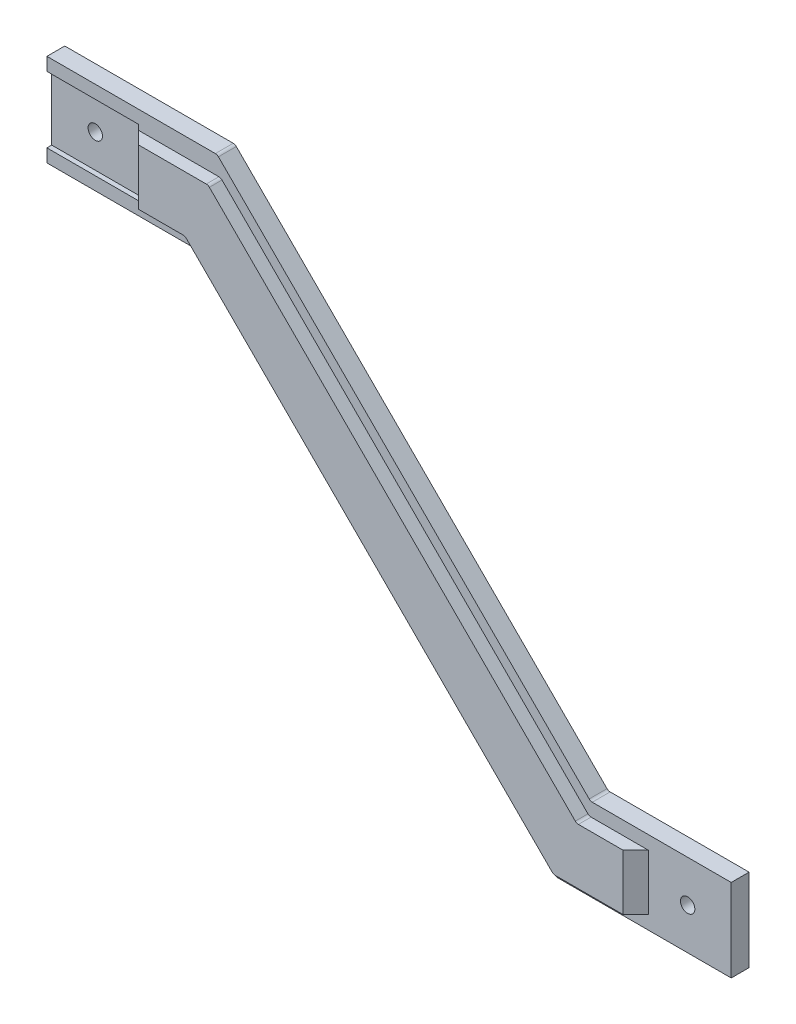
from build123d import *

# Parameters (mm, degrees)
SKETCH_1_R          = 1.65
EXTRUDE_1_DEPTH     = 3
EXTRUDE_2_DEPTH     = 2.9
CHAMFER_1_SIZE      = 2.9
EXTRUDE_START       = -1.1
SKETCH_6_R          = 1.65
EXTRUDE_3_DEPTH     = 4.1
CUT_EXTRUDE_START   = 3
SKETCH_7_W          = 21
SKETCH_7_H          = 15.2
CUT_EXTRUDE_1_DEPTH = 1.1
FILLET_1_R          = 1


with BuildPart() as part:
    # 草图1 → 凸台-拉伸1 (new body)
    with BuildSketch(Plane.XY):
        Polygon((-78.55, 51.8), (-38.364971157, 51.8), (46.235028843, -32.8), (78.55, -32.8), (78.55, -51.8), (38.364971157, -51.8), (-46.235028843, 32.8), (-78.55, 32.8), align=None)
        with Locations((-68.55, 42.3)):
            Circle(SKETCH_1_R, mode=Mode.SUBTRACT)
        with Locations((68.55, -42.3)):
            Circle(SKETCH_1_R, mode=Mode.SUBTRACT)
    extrude(amount=EXTRUDE_1_DEPTH)

    # 草图2 → 凸台-拉伸2 (add)
    with BuildSketch(Plane.XY.offset(3)):
        Polygon((-57.55, 48.7), (-57.55, 35.9), (-43.950966799, 35.9), (40.649033201, -48.7), (59.55, -48.7), (59.55, -35.9), (45.950966799, -35.9), (-38.649033201, 48.7), align=None)
    extrude(amount=EXTRUDE_2_DEPTH)

    # 倒角1
    chamfer_1_edges = [part.edges().sort_by_distance(p)[0] for p in [
        (59.55, -42.3, 5.9),
        (-57.55, 42.3, 5.9),
    ]]
    chamfer(chamfer_1_edges, length=CHAMFER_1_SIZE - 0.0001)  # a hair under: the kernel refuses the full size

    # 草图6 → 凸台-拉伸3 (add)
    with BuildSketch(Plane.XY.offset(EXTRUDE_START)):
        Polygon((-78.55, 52.9), (-78.55, 31.7), (-45.135028843, 31.7), (38.364971157, -51.8), (78.55, -51.8), (78.55, -32.8), (46.235028843, -32.8), (-39.464971157, 52.9), align=None)
        with Locations((-68.55, 42.3)):
            Circle(SKETCH_6_R, mode=Mode.SUBTRACT)
        with Locations((68.55, -42.3)):
            Circle(SKETCH_6_R, mode=Mode.SUBTRACT)
    extrude(amount=EXTRUDE_3_DEPTH)

    # 草图7 → 切除-拉伸1 (cut)
    with BuildSketch(Plane.XY.offset(CUT_EXTRUDE_START)):
        with Locations((-68.05, 42.3)):
            Rectangle(SKETCH_7_W, SKETCH_7_H)
    extrude(amount=-CUT_EXTRUDE_1_DEPTH, mode=Mode.SUBTRACT)

    # 圆角1
    fillet_1_edges = [part.edges().sort_by_distance(p)[0] for p in [
        (46.235028843, -32.8, 0.95),
        (38.364971157, -51.8, 0.95),
        (-38.649033201, 48.7, 4.45),
        (-43.950966799, 35.9, 4.45),
        (40.649033201, -48.7, 4.45),
        (45.950966799, -35.9, 4.45),
        (-39.464971157, 52.9, 0.95),
        (-45.135028843, 31.7, 0.95),
    ]]
    fillet(fillet_1_edges, radius=FILLET_1_R)


solid = part.part
